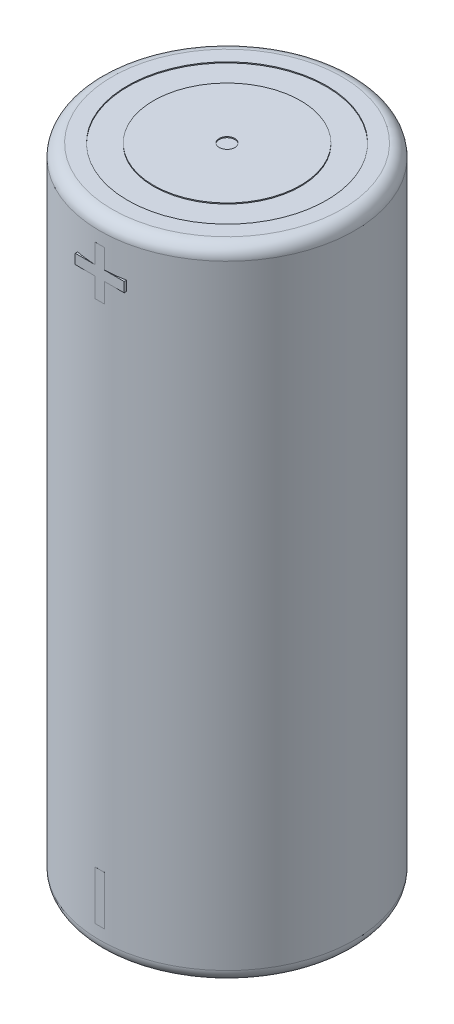
from build123d import *

# Parameters (mm, degrees)
SKETCH1_R           = 13
BOSS_EXTRUDE1_DEPTH = 65.25
FILLET1_R           = 1.27
FILLET2_R           = 1.27
SKETCH2_W           = 1
SKETCH2_H           = 5
BOSS_EXTRUDE2_DEPTH = 10
SKETCH5_R           = 10.15
SKETCH5_R_2         = 7.5
SKETCH5_R_3         = 0.8
CUT_EXTRUDE1_DEPTH  = 0.1
SKETCH6_R           = 9.2
SKETCH6_R_2         = 7.15
CUT_EXTRUDE2_DEPTH  = 0.1
SKETCH7_R           = 7.15
SKETCH7_R_2         = 6.35
SKETCH7_R_3         = 1.625
CUT_EXTRUDE3_DEPTH  = 0.25
CHAMFER1_SIZE       = 0.1


with BuildPart() as part:
    # Sketch1 → Boss-Extrude1 (new body)
    with BuildSketch(Plane(origin=(0, 0, 0), x_dir=(1, 0, 0), z_dir=(0, 1, 0))):
        Circle(SKETCH1_R)
    extrude(amount=BOSS_EXTRUDE1_DEPTH)

    # Fillet1
    fillet1_edges = [part.edges().sort_by_distance(p)[0] for p in [
        (-13, 65.25, 0),
    ]]
    fillet(fillet1_edges, radius=FILLET1_R)

    # Fillet2
    fillet2_edges = [part.edges().sort_by_distance(p)[0] for p in [
        (-13, 0, 0),
    ]]
    fillet(fillet2_edges, radius=FILLET2_R)

    # Sketch2 → Boss-Extrude2 (add)
    with BuildSketch(Plane.XY.offset(13)):
        Polygon((0.5, 62.75), (-0.5, 62.75), (-0.5, 60.75), (-2.5, 60.75), (-2.5, 59.75), (-0.5, 59.75), (-0.5, 57.75), (0.5, 57.75), (0.5, 59.75), (2.5, 59.75), (2.5, 60.75), (0.5, 60.75), align=None)
        with Locations((0, 5)):
            Rectangle(SKETCH2_W, SKETCH2_H)
    extrude(amount=-BOSS_EXTRUDE2_DEPTH)

    # Sketch5 → Cut-Extrude1 (cut)
    # profile 1 of 2: a face of its own
    with BuildSketch(Plane(origin=(0, 65.25, 0), x_dir=(1, 0, 0), z_dir=(0, 1, 0))):
        Circle(SKETCH5_R)
        Circle(SKETCH5_R_2, mode=Mode.SUBTRACT)
    # profile 2 of 2: a face of its own
    with BuildSketch(Plane(origin=(0, 65.25, 0), x_dir=(1, 0, 0), z_dir=(0, 1, 0))):
        Circle(SKETCH5_R_3)
    extrude(amount=-CUT_EXTRUDE1_DEPTH, mode=Mode.SUBTRACT)

    # Sketch6 → Cut-Extrude2 (cut)
    with BuildSketch(Plane.XZ):
        Circle(SKETCH6_R)
        Circle(SKETCH6_R_2, mode=Mode.SUBTRACT)
    extrude(amount=-CUT_EXTRUDE2_DEPTH, mode=Mode.SUBTRACT)

    # Sketch7 → Cut-Extrude3 (cut)
    # profile 1 of 2: a face of its own
    with BuildSketch(Plane.XZ):
        Circle(SKETCH7_R)
        Circle(SKETCH7_R_2, mode=Mode.SUBTRACT)
    # profile 2 of 2: a face of its own
    with BuildSketch(Plane.XZ):
        Circle(SKETCH7_R_3)
    extrude(amount=-CUT_EXTRUDE3_DEPTH, mode=Mode.SUBTRACT)

    # Chamfer1
    chamfer1_edges = [part.edges().sort_by_distance(p)[0] for p in [
        (-6.35, 0, 0),
    ]]
    chamfer(chamfer1_edges, length=CHAMFER1_SIZE)


solid = part.part
